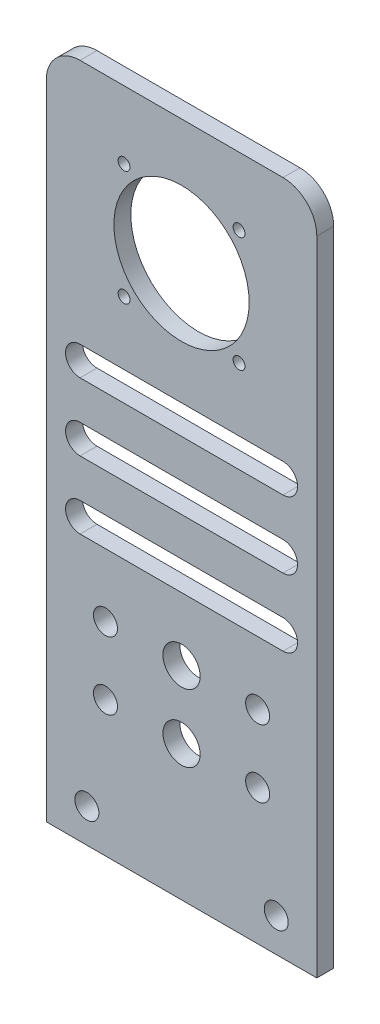
from build123d import *

# Parameters (mm, degrees)
SKETCH_1_R          = 3.55
SKETCH_1_R_2        = 1.75
EXTRUDE_1_DEPTH     = 5
FILLET_1_R          = 10
FILLET_2_R          = 10
SKETCH_2_R          = 3.55
SKETCH_2_R_2        = 5.5
CUT_EXTRUDE_2_DEPTH = 216.464614264


with BuildPart() as part:
    # 草图1 → 凸台-拉伸1 (new body)
    with BuildSketch(Plane.XY):
        Polygon((0, 0), (80, 0), (80, 200), (40, 200), (0, 200), align=None)
        with Locations((12, 10)):
            Circle(SKETCH_1_R, mode=Mode.SUBTRACT)
        with Locations((68, 10)):
            Circle(SKETCH_1_R, mode=Mode.SUBTRACT)
        with Locations((62.5, 40)):
            Circle(SKETCH_1_R, mode=Mode.SUBTRACT)
        with Locations((17.5, 40)):
            Circle(SKETCH_1_R, mode=Mode.SUBTRACT)
        with BuildLine():
            ThreePointArc((45.5, 40), (43.889087297, 36.110912703), (40, 34.5))
            ThreePointArc((40, 34.5), (36.110912703, 43.889087297), (45.5, 40))
        make_face(mode=Mode.SUBTRACT)
        with Locations((23, 146)):
            Circle(SKETCH_1_R_2, mode=Mode.SUBTRACT)
        with BuildLine():
            ThreePointArc((40, 143), (20, 163), (40, 183))
            ThreePointArc((40, 183), (45.477225575, 182.235384062), (50.535653753, 180))
            ThreePointArc((50.535653753, 180), (60, 163), (50.535653753, 146))
            ThreePointArc((50.535653753, 146), (45.477225575, 143.764615938), (40, 143))
        make_face(mode=Mode.SUBTRACT)
        with Locations((23, 180)):
            Circle(SKETCH_1_R_2, mode=Mode.SUBTRACT)
        with BuildLine():
            Line((10, 127.3), (40, 127.3))
            Line((40, 127.3), (70, 127.3))
            ThreePointArc((70, 127.3), (74.3, 123), (70, 118.7))
            Line((70, 118.7), (10, 118.7))
            ThreePointArc((10, 118.7), (5.7, 123), (10, 127.3))
        make_face(mode=Mode.SUBTRACT)
        with Locations((57, 146)):
            Circle(SKETCH_1_R_2, mode=Mode.SUBTRACT)
        with Locations((57, 180)):
            Circle(SKETCH_1_R_2, mode=Mode.SUBTRACT)
    extrude(amount=EXTRUDE_1_DEPTH)

    # 圆角1
    fillet_1_edges = [part.edges().sort_by_distance(p)[0] for p in [
        (0, 200, 2.5),
    ]]
    fillet(fillet_1_edges, radius=FILLET_1_R)

    # 圆角2
    fillet_2_edges = [part.edges().sort_by_distance(p)[0] for p in [
        (80, 200, 2.5),
    ]]
    fillet(fillet_2_edges, radius=FILLET_2_R)

    # 草图2 → 切除-拉伸2 (cut, through all)
    with BuildSketch(Plane.XY.offset(5)):
        with Locations((17.5, 40)):
            Circle(SKETCH_2_R)
        with Locations((40, 40)):
            Circle(SKETCH_2_R_2)
        with Locations((62.5, 40)):
            Circle(SKETCH_2_R)
        with Locations((62.5, 60)):
            Circle(SKETCH_2_R)
        with Locations((40, 60)):
            Circle(SKETCH_2_R_2)
        with Locations((17.5, 60)):
            Circle(SKETCH_2_R)
        with BuildLine():
            Line((10, 127.3), (70, 127.3))
            ThreePointArc((70, 127.3), (74.3, 123), (70, 118.7))
            Line((70, 118.7), (10, 118.7))
            ThreePointArc((10, 118.7), (5.7, 123), (10, 127.3))
        make_face()
        with BuildLine():
            Line((10, 107.3), (70, 107.3))
            ThreePointArc((70, 107.3), (74.3, 103), (70, 98.7))
            Line((70, 98.7), (10, 98.7))
            ThreePointArc((10, 98.7), (5.7, 103), (10, 107.3))
        make_face()
        with BuildLine():
            Line((10, 87.3), (70, 87.3))
            ThreePointArc((70, 87.3), (74.3, 83), (70, 78.7))
            Line((70, 78.7), (10, 78.7))
            ThreePointArc((10, 78.7), (5.7, 83), (10, 87.3))
        make_face()
    extrude(amount=-CUT_EXTRUDE_2_DEPTH, mode=Mode.SUBTRACT)


solid = part.part
